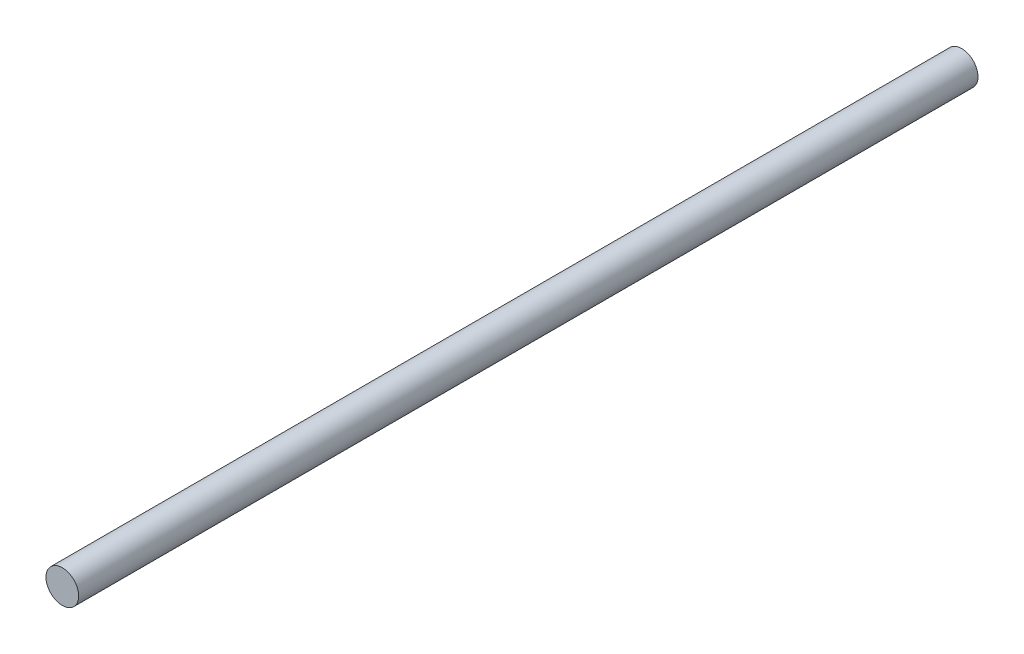
from build123d import *

# Parameters (mm, degrees)
SKIZZE1_R                       = 4
AUFSATZ_LINEAR_AUSTRAGEN1_DEPTH = 220


with BuildPart() as part:
    # Skizze1 → Aufsatz-Linear austragen1 (new body)
    with BuildSketch(Plane.XY):
        Circle(SKIZZE1_R)
    extrude(amount=AUFSATZ_LINEAR_AUSTRAGEN1_DEPTH)


solid = part.part
